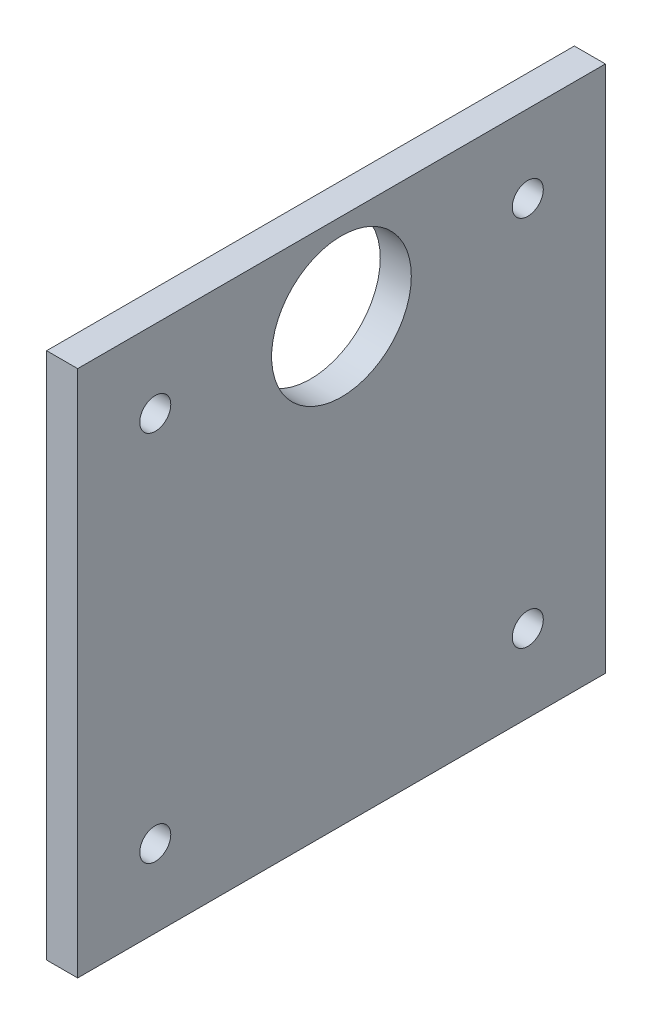
from build123d import *

# Parameters (mm, degrees)
SKETCH1_W           = 107.95
SKETCH1_H           = 107.95
SKETCH1_R           = 14.2875
SKETCH1_R_2         = 3.175
BOSS_EXTRUDE1_DEPTH = 3.175


with BuildPart() as part:
    # Sketch1 → Boss-Extrude1 (new, symmetric)
    with BuildSketch(Plane(origin=(0, 0, 0), x_dir=(0, 0, -1), z_dir=(1, 0, 0))):
        Rectangle(SKETCH1_W, SKETCH1_H)
        with Locations((-0.01209836, 36.238790346)):
            Circle(SKETCH1_R, mode=Mode.SUBTRACT)
        with Locations((-38.1, 38.1)):
            Circle(SKETCH1_R_2, mode=Mode.SUBTRACT)
        with Locations((38.1, 38.1)):
            Circle(SKETCH1_R_2, mode=Mode.SUBTRACT)
        with Locations((38.1, -38.1)):
            Circle(SKETCH1_R_2, mode=Mode.SUBTRACT)
        with Locations((-38.1, -38.1)):
            Circle(SKETCH1_R_2, mode=Mode.SUBTRACT)
    extrude(amount=BOSS_EXTRUDE1_DEPTH, both=True)


solid = part.part
